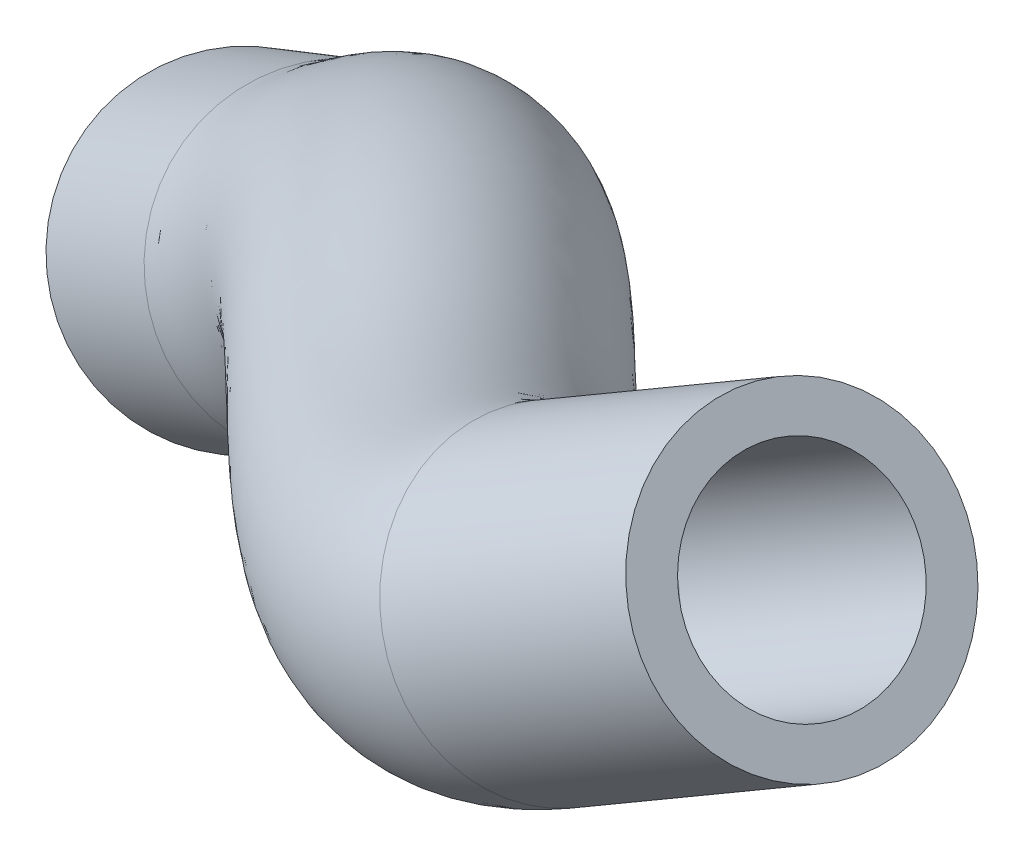
from build123d import *

# Parameters (mm, degrees)
SWEEP1_PROFILE_R     = 13.49375
CUT_SWEEP1_PROFILE_R = 9.525


with BuildPart() as part:
    # Sweep1: sweep along a curve in space
    with BuildLine() as sweep1_path:
        Line((-45.48155133, -0.382317265, -56.566611319), (-26.413409687, 13.143539415, -46.635993243))
        add(Edge.make_bspline(
            [(-26.413409687, 13.143539415, -46.635993243), (-18.748962913, 18.580262644, -42.644377535), (-10.244427242, 30.13312932, -39.128590292), (36.80202733, 46.098731017, 8.619113025), (52.810468388, 56.994215675, 17.711692205), (58.640818132, 60.732068928, 18.509664161)],
            knots=[0, 0, 0, 0, 0.436474419, 0.623536848, 1, 1, 1, 1], degree=3))
        Line((58.640818132, 60.732068928, 18.509664161), (85.193871243, 77.755304291, 22.14385296))
    # Sweep1 profile (on start of the path) → Sweep1 (sweep)
    with BuildSketch(Plane(origin=(-45.48155133, -0.382317265, -56.566611319), x_dir=(-0.5785656996305997, 0.8156357834296841, 0), z_dir=(0.7507142378800882, 0.5325140425244594, 0.39096921561470394))):
        Circle(SWEEP1_PROFILE_R)
    sweep(path=sweep1_path.line)

    # Cut-Sweep1: sweep along a curve in space
    with BuildLine() as cut_sweep1_path:
        Line((-45.48155133, -0.382317265, -56.566611319), (-26.413409687, 13.143539415, -46.635993243))
        add(Edge.make_bspline(
            [(-26.413409687, 13.143539415, -46.635993243), (-18.748962913, 18.580262644, -42.644377535), (-10.244427242, 30.13312932, -39.128590292), (36.80202733, 46.098731017, 8.619113025), (52.810468388, 56.994215675, 17.711692205), (58.640818132, 60.732068928, 18.509664161)],
            knots=[0, 0, 0, 0, 0.436474419, 0.623536848, 1, 1, 1, 1], degree=3))
        Line((58.640818132, 60.732068928, 18.509664161), (85.193871243, 77.755304291, 22.14385296))
    # Cut-Sweep1 profile (on start of the path) → Cut-Sweep1 (sweep, cut)
    with BuildSketch(Plane(origin=(-45.48155133, -0.382317265, -56.566611319), x_dir=(-0.5785656996305997, 0.8156357834296841, 0), z_dir=(0.7507142378800882, 0.5325140425244594, 0.39096921561470394))):
        Circle(CUT_SWEEP1_PROFILE_R)
    sweep(path=cut_sweep1_path.line, mode=Mode.SUBTRACT)


solid = part.part
